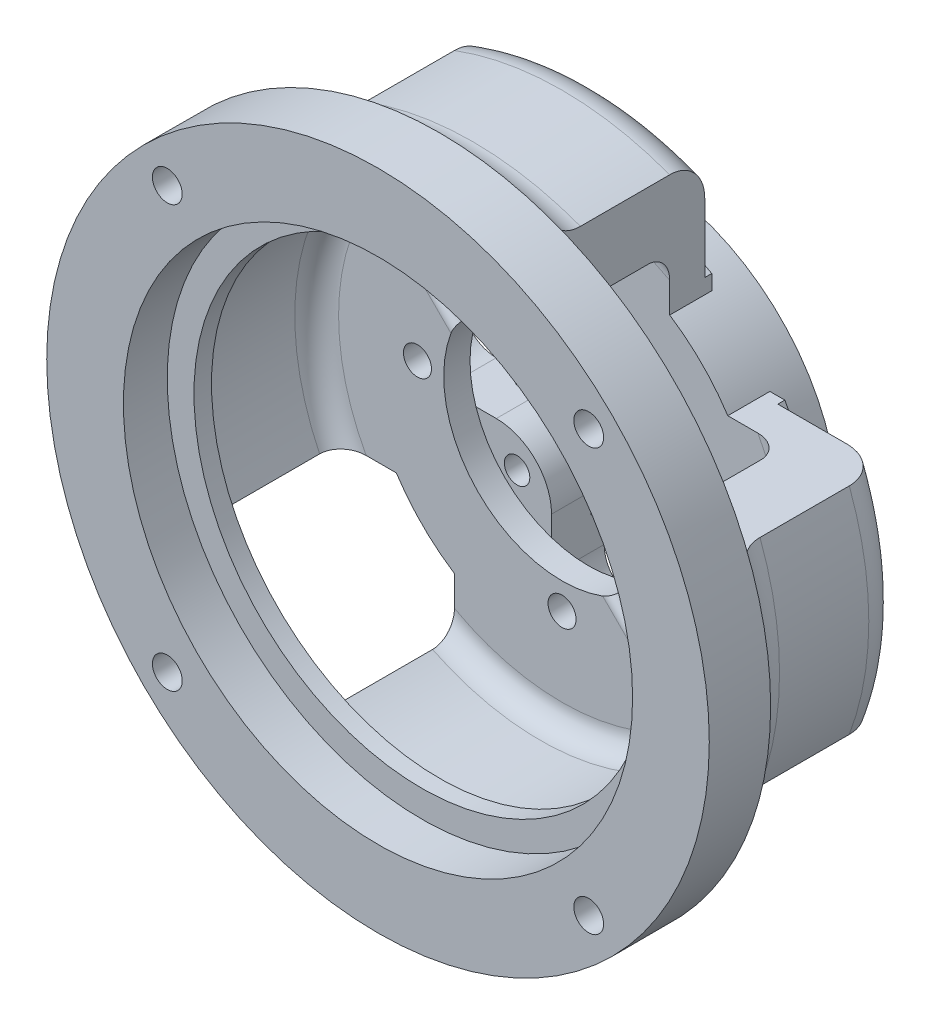
from build123d import *

# Parameters (mm, degrees)
SKETCH_1_W                    = 37.8
SKETCH_1_H                    = 6
CUT_EXTRUDE_1_DEPTH           = 2.5
HOLE_WIZARD_M48_1_D           = 52
HOLE_WIZARD_M48_1_CBORE_D     = 58.1
HOLE_WIZARD_M48_1_CBORE_DEPTH = 4
CUT_EXTRUDE_2_DEPTH           = 54.792936339
CUT_EXTRUDE_2_DEPTH_BACK      = 6
SKETCH_17_R                   = 1.7
SKETCH_18_R                   = 35
EXTRUDE_1_DEPTH               = 23
SKETCH_19_R                   = 28
CUT_EXTRUDE_3_DEPTH           = 14
CUT_EXTRUDE_START             = -23
SKETCH_20_R                   = 13.5
CUT_EXTRUDE_5_DEPTH           = 23
CUT_EXTRUDE_6_DEPTH           = 6
SKETCH_22_R                   = 1.6
CUT_EXTRUDE_7_DEPTH           = 3
SKETCH_24_R                   = 1.45
EXTRUDE_2_DEPTH               = 4.5
CUT_EXTRUDE_START_2           = -5
SKETCH_25_R                   = 35
SKETCH_25_R_2                 = 24
CUT_EXTRUDE_8_DEPTH           = 5
CUT_EXTRUDE_START_3           = -4.2
SKETCH_27_R                   = 24
SKETCH_27_R_2                 = 22.55
CUT_EXTRUDE_9_DEPTH           = 4.2
CUT_EXTRUDE_10_DEPTH          = 1.5
FILLET_1_R                    = 4
FILLET_2_R                    = 2.5
CUT_EXTRUDE_11_DEPTH          = 76.28451395
CUT_EXTRUDE_11_DEPTH_BACK     = 76.28451395
SKETCH_31_W                   = 9.376817256
SKETCH_31_H                   = 2.4
FILLET_3_R                    = 1
FILLET_4_R                    = 4
SKETCH_33_R                   = 37.8
SKETCH_33_R_2                 = 29.05
SKETCH_33_R_3                 = 1.7
EXTRUDE_3_DEPTH               = 1


with BuildPart() as part:
    # 草图1 → 旋转1 (revolve)
    with BuildSketch(Plane(origin=(0, 0, 0), x_dir=(1, 0, 0), z_dir=(0, 1, 0))):
        with Locations((18.9, 27.010169219)):
            Rectangle(SKETCH_1_W, SKETCH_1_H)
    revolve(axis=Axis((0, 0, -30.010169219), (0, 0, 1)))

    # 草图2 → 切除-拉伸1 (cut)
    with BuildSketch(Plane(origin=(0, 0, -30.010169219), x_dir=(-1, 0, 0), z_dir=(0, 0, -1))):
        Polygon((-22.439483563, -21.26663056), (-25.643777557, -21.26663056), (-27.245924554, -24.04163056), (-25.643777557, -26.81663056), (-22.439483563, -26.81663056), (-20.837336566, -24.04163056), align=None)
        Polygon((-24.04163056, 27.245924554), (-26.81663056, 25.643777557), (-26.81663056, 22.439483563), (-24.04163056, 20.837336566), (-21.26663056, 22.439483563), (-21.26663056, 25.643777557), align=None)
        Polygon((27.245924554, 24.04163056), (25.643777557, 26.81663056), (22.439483563, 26.81663056), (20.837336566, 24.04163056), (22.439483563, 21.26663056), (25.643777557, 21.26663056), align=None)
        Polygon((24.04163056, -27.245924554), (26.81663056, -25.643777557), (26.81663056, -22.439483563), (24.04163056, -20.837336566), (21.26663056, -22.439483563), (21.26663056, -25.643777557), align=None)
    extrude(amount=-CUT_EXTRUDE_1_DEPTH, mode=Mode.SUBTRACT)

    # M48 六角头螺栓的柱形沉头孔1 (through all)
    with Locations(Plane.XY.offset(-24.010169219)):
        with Locations((0, 0)):
            CounterBoreHole(HOLE_WIZARD_M48_1_D / 2, HOLE_WIZARD_M48_1_CBORE_D / 2, HOLE_WIZARD_M48_1_CBORE_DEPTH)

    # 草图17 → 切除-拉伸2 (cut, two sides: drawn at the far end of the back side and taken through both)
    with BuildSketch(Plane(origin=(0, 0, -30.010169219), x_dir=(-1, 0, 0), z_dir=(0, 0, -1)).offset(-CUT_EXTRUDE_2_DEPTH_BACK)):
        with Locations(Location((-24.04163056, -24.04163056, 0), (0, 0, 180))):
            Circle(SKETCH_17_R)
        with Locations(Location((-24.04163056, 24.04163056, 0), (0, 0, 180))):
            Circle(SKETCH_17_R)
        with Locations(Location((24.04163056, 24.04163056, 0), (0, 0, 180))):
            Circle(SKETCH_17_R)
        with Locations(Location((24.04163056, -24.04163056, 0), (0, 0, 180))):
            Circle(SKETCH_17_R)
    extrude(amount=CUT_EXTRUDE_2_DEPTH + CUT_EXTRUDE_2_DEPTH_BACK, mode=Mode.SUBTRACT)

    # 草图18 → 凸台-拉伸1 (add)
    with BuildSketch(Plane(origin=(0, 0, -30.010169219), x_dir=(-1, 0, 0), z_dir=(0, 0, -1))):
        with Locations(Location((0, 0, 0), (0, 0, 140.012926648))):
            Circle(SKETCH_18_R)
    extrude(amount=EXTRUDE_1_DEPTH)

    # 草图19 → 切除-拉伸3 (cut)
    with BuildSketch(Plane.XY.offset(-30.010169219)):
        Circle(SKETCH_19_R)
    extrude(amount=-CUT_EXTRUDE_3_DEPTH, mode=Mode.SUBTRACT)

    # 草图20 → 切除-拉伸5 (cut)
    with BuildSketch(Plane(origin=(0, 0, -53.010169219), x_dir=(-1, 0, 0), z_dir=(0, 0, -1)).offset(CUT_EXTRUDE_START)):
        with BuildLine():
            ThreePointArc((-12.28161024, -18.912021307), (-15.945257916, -15.945257916), (-18.912021307, -12.28161024))
            Line((-18.912021307, -12.28161024), (-32.774411511, -12.28161024))
            ThreePointArc((-32.774411511, -12.28161024), (-24.748737342, -24.748737342), (-12.28161024, -32.774411511))
            Line((-12.28161024, -32.774411511), (-12.28161024, -18.912021307))
        make_face()
        with BuildLine():
            ThreePointArc((-12.28161024, 32.774411511), (-24.748737342, 24.748737342), (-32.774411511, 12.28161024))
            Line((-32.774411511, 12.28161024), (-18.912021307, 12.28161024))
            ThreePointArc((-18.912021307, 12.28161024), (-15.945257916, 15.945257916), (-12.28161024, 18.912021307))
            Line((-12.28161024, 18.912021307), (-12.28161024, 32.774411511))
        make_face()
        with BuildLine():
            Line((12.28161024, -18.912021307), (12.28161024, -32.774411511))
            ThreePointArc((12.28161024, -32.774411511), (24.748737342, -24.748737342), (32.774411511, -12.28161024))
            Line((32.774411511, -12.28161024), (18.912021307, -12.28161024))
            ThreePointArc((18.912021307, -12.28161024), (15.945257916, -15.945257916), (12.28161024, -18.912021307))
        make_face()
        with BuildLine():
            ThreePointArc((32.774411511, 12.28161024), (24.748737342, 24.748737342), (12.28161024, 32.774411511))
            Line((12.28161024, 32.774411511), (12.28161024, 18.912021307))
            ThreePointArc((12.28161024, 18.912021307), (15.945257916, 15.945257916), (18.912021307, 12.28161024))
            Line((18.912021307, 12.28161024), (32.774411511, 12.28161024))
        make_face()
        Circle(SKETCH_20_R)
    extrude(amount=CUT_EXTRUDE_5_DEPTH, mode=Mode.SUBTRACT)

    # 草图21 → 切除-拉伸6 (cut)
    with BuildSketch(Plane(origin=(0, 0, -53.010169219), x_dir=(-1, 0, 0), z_dir=(0, 0, -1))):
        with BuildLine():
            Line((-4.2, 16.5), (-4.2, 10.5))
            ThreePointArc((-4.2, 10.5), (-6.045227279, 6.045227279), (-10.5, 4.2))
            Line((-10.5, 4.2), (-16.5, 4.2))
            ThreePointArc((-16.5, 4.2), (-19.328427125, 3.028427125), (-20.5, 0.2))
            Line((-20.5, 0.2), (-20.5, -0.2))
            ThreePointArc((-20.5, -0.2), (-19.328427125, -3.028427125), (-16.5, -4.2))
            Line((-16.5, -4.2), (-10.5, -4.2))
            ThreePointArc((-10.5, -4.2), (-6.045227279, -6.045227279), (-4.2, -10.5))
            Line((-4.2, -10.5), (-4.2, -16.5))
            ThreePointArc((-4.2, -16.5), (-3.028427125, -19.328427125), (-0.2, -20.5))
            Line((-0.2, -20.5), (0.2, -20.5))
            ThreePointArc((0.2, -20.5), (3.028427125, -19.328427125), (4.2, -16.5))
            Line((4.2, -16.5), (4.2, -10.5))
            ThreePointArc((4.2, -10.5), (6.045227279, -6.045227279), (10.5, -4.2))
            Line((10.5, -4.2), (16.5, -4.2))
            ThreePointArc((16.5, -4.2), (19.328427125, -3.028427125), (20.5, -0.2))
            Line((20.5, -0.2), (20.5, 0.2))
            ThreePointArc((20.5, 0.2), (19.328427125, 3.028427125), (16.5, 4.2))
            Line((16.5, 4.2), (10.5, 4.2))
            ThreePointArc((10.5, 4.2), (6.045227279, 6.045227279), (4.2, 10.5))
            Line((4.2, 10.5), (4.2, 16.5))
            ThreePointArc((4.2, 16.5), (3.028427125, 19.328427125), (0.2, 20.5))
            Line((0.2, 20.5), (-0.2, 20.5))
            ThreePointArc((-0.2, 20.5), (-3.028427125, 19.328427125), (-4.2, 16.5))
        make_face()
    extrude(amount=-CUT_EXTRUDE_6_DEPTH, mode=Mode.SUBTRACT)

    # 草图22 → 切除-拉伸7 (cut)
    with BuildSketch(Plane(origin=(0, 0, -47.010169219), x_dir=(-1, 0, 0), z_dir=(0, 0, -1))):
        with Locations((-16.5, 0)):
            Circle(SKETCH_22_R)
        with Locations((0, 16.5)):
            Circle(SKETCH_22_R)
        with Locations((16.5, 0)):
            Circle(SKETCH_22_R)
        with Locations((0, -16.5)):
            Circle(SKETCH_22_R)
    extrude(amount=-CUT_EXTRUDE_7_DEPTH, mode=Mode.SUBTRACT)

    # 草图24 → 凸台-拉伸2 (add)
    # profile 1 of 4: a face of its own
    with BuildSketch(Plane(origin=(0, 0, -47.010169219), x_dir=(-1, 0, 0), z_dir=(0, 0, -1))):
        with BuildLine():
            Line((-10.5, -4.2), (-12.830042868, -4.2))
            ThreePointArc((-12.830042868, -4.2), (-9.545941546, -9.545941546), (-4.2, -12.830042868))
            Line((-4.2, -12.830042868), (-4.2, -10.5))
            ThreePointArc((-4.2, -10.5), (-6.045227279, -6.045227279), (-10.5, -4.2))
        make_face()
        with Locations((-8.131727984, -8.131727984)):
            Circle(SKETCH_24_R, mode=Mode.SUBTRACT)
    # profile 2 of 4: a face of its own
    with BuildSketch(Plane(origin=(0, 0, -47.010169219), x_dir=(-1, 0, 0), z_dir=(0, 0, -1))):
        with BuildLine():
            ThreePointArc((-4.2, 12.830042868), (-9.545941546, 9.545941546), (-12.830042868, 4.2))
            Line((-12.830042868, 4.2), (-10.5, 4.2))
            ThreePointArc((-10.5, 4.2), (-6.045227279, 6.045227279), (-4.2, 10.5))
            Line((-4.2, 10.5), (-4.2, 12.830042868))
        make_face()
        with Locations((-8.131727984, 8.131727984)):
            Circle(SKETCH_24_R, mode=Mode.SUBTRACT)
    # profile 3 of 4: a face of its own
    with BuildSketch(Plane(origin=(0, 0, -47.010169219), x_dir=(-1, 0, 0), z_dir=(0, 0, -1))):
        with BuildLine():
            Line((4.2, -10.5), (4.2, -12.830042868))
            ThreePointArc((4.2, -12.830042868), (9.545941546, -9.545941546), (12.830042868, -4.2))
            Line((12.830042868, -4.2), (10.5, -4.2))
            ThreePointArc((10.5, -4.2), (6.045227279, -6.045227279), (4.2, -10.5))
        make_face()
        with Locations((8.131727984, -8.131727984)):
            Circle(SKETCH_24_R, mode=Mode.SUBTRACT)
    # profile 4 of 4: a face of its own
    with BuildSketch(Plane(origin=(0, 0, -47.010169219), x_dir=(-1, 0, 0), z_dir=(0, 0, -1))):
        with BuildLine():
            ThreePointArc((12.830042868, 4.2), (9.545941546, 9.545941546), (4.2, 12.830042868))
            Line((4.2, 12.830042868), (4.2, 10.5))
            ThreePointArc((4.2, 10.5), (6.045227279, 6.045227279), (10.5, 4.2))
            Line((10.5, 4.2), (12.830042868, 4.2))
        make_face()
        with Locations((8.131727984, 8.131727984)):
            Circle(SKETCH_24_R, mode=Mode.SUBTRACT)
    extrude(amount=EXTRUDE_2_DEPTH)

    # 草图25 → 切除-拉伸8 (cut)
    with BuildSketch(Plane(origin=(0, 0, -53.010169219), x_dir=(-1, 0, 0), z_dir=(0, 0, -1)).offset(CUT_EXTRUDE_START_2)):
        Circle(SKETCH_25_R)
        Circle(SKETCH_25_R_2, mode=Mode.SUBTRACT)
    extrude(amount=CUT_EXTRUDE_8_DEPTH, mode=Mode.SUBTRACT)

    # 草图27 → 切除-拉伸9 (cut)
    with BuildSketch(Plane(origin=(0, 0, -53.010169219), x_dir=(-1, 0, 0), z_dir=(0, 0, -1)).offset(CUT_EXTRUDE_START_3)):
        Circle(SKETCH_27_R)
        Circle(SKETCH_27_R_2, mode=Mode.SUBTRACT)
    extrude(amount=CUT_EXTRUDE_9_DEPTH, mode=Mode.SUBTRACT)

    # 草图29 → 切除-拉伸10 (cut)
    with BuildSketch(Plane(origin=(0, 0, -53.010169219), x_dir=(-1, 0, 0), z_dir=(0, 0, -1))):
        with BuildLine():
            Line((-9.5, 11.5), (9.5, 11.5))
            ThreePointArc((9.5, 11.5), (10.914213562, 10.914213562), (11.5, 9.5))
            Line((11.5, 9.5), (11.5, -9.5))
            ThreePointArc((11.5, -9.5), (10.914213562, -10.914213562), (9.5, -11.5))
            Line((9.5, -11.5), (-9.5, -11.5))
            ThreePointArc((-9.5, -11.5), (-10.914213562, -10.914213562), (-11.5, -9.5))
            Line((-11.5, -9.5), (-11.5, 9.5))
            ThreePointArc((-11.5, 9.5), (-10.914213562, 10.914213562), (-9.5, 11.5))
        make_face()
    extrude(amount=-CUT_EXTRUDE_10_DEPTH, mode=Mode.SUBTRACT)

    # 圆角1
    fillet_1_edges = [part.edges().sort_by_distance(p)[0] for p in [
        (35, 0, -48.010169219),
        (0, 35, -48.010169219),
        (-35, 0, -48.010169219),
        (0, -35, -48.010169219),
    ]]
    fillet(fillet_1_edges, radius=FILLET_1_R)

    # 圆角2
    fillet_2_edges = [part.edges().sort_by_distance(p)[0] for p in [
        (0, 28, -44.010169219),
        (-28, 0, -44.010169219),
        (0, -28, -44.010169219),
        (28, 0, -44.010169219),
    ]]
    fillet(fillet_2_edges, radius=FILLET_2_R)

    # 草图31 → 切除-拉伸11 (cut, two sides: drawn at the far end of the back side and taken through both)
    with BuildSketch(Plane(origin=(0, 0, 0), x_dir=(-0.7071067811865476, -0.7071067811865476, 0), z_dir=(0.7071067811865476, -0.7071067811865476, 0)).offset(-CUT_EXTRUDE_11_DEPTH_BACK)):
        with Locations((0, 45.210169219)):
            Rectangle(SKETCH_31_W, SKETCH_31_H)
    extrude(amount=CUT_EXTRUDE_11_DEPTH + CUT_EXTRUDE_11_DEPTH_BACK, mode=Mode.SUBTRACT)

    # 圆角3
    # the kernel refuses this fillet: 1 mm, written as the material it adds along each edge
    with BuildSketch(Plane(origin=(20.67978826, -14.049377193, -46.410169219), x_dir=(0, 0, 1), z_dir=(-0.7071067811865476, 0.7071067811865476, 0))) as fillet_3_piece_1_section:
        with BuildLine():
            CenterArc((FILLET_3_R, -FILLET_3_R), FILLET_3_R, 90, 90)
            Line((0, -FILLET_3_R), (0, 0))
            Line((0, 0), (FILLET_3_R, 0))
        make_face()
    fillet_3_piece_1 = extrude(amount=14.397495993, mode=Mode.PRIVATE)
    fillet_3_piece_1 = split(fillet_3_piece_1, bisect_by=Plane(origin=(18.487201152, -12.28161024, -46.303314163), z_dir=(0, -1, 0)), keep=Keep.TOP, mode=Mode.PRIVATE)
    fillet_3_piece_1 = fillet_3_piece_1 & Plane(origin=(0, 0, -46.303314163), x_dir=(0.5446390350150296, -0.8386705679454224, 0), z_dir=(0, 0, 1)) * Cylinder(22.55, 33, mode=Mode.PRIVATE)
    add(fillet_3_piece_1)
    with BuildSketch(Plane(origin=(20.67978826, -14.049377193, -46.410169219), x_dir=(0, 0, 1), z_dir=(-0.7071067811865476, 0.7071067811865476, 0))) as fillet_3_piece_2_section:
        with BuildLine():
            CenterArc((FILLET_3_R, -FILLET_3_R), FILLET_3_R, 90, 90)
            Line((0, -FILLET_3_R), (0, 0))
            Line((0, 0), (FILLET_3_R, 0))
        make_face()
    fillet_3_piece_2 = extrude(amount=14.397495993, mode=Mode.PRIVATE)
    fillet_3_piece_2 = split(fillet_3_piece_2, bisect_by=Plane(origin=(15.383550051, -12.28161024, -46.179741541), z_dir=(0, 1, 0)), keep=Keep.TOP, mode=Mode.PRIVATE)
    fillet_3_piece_2 = fillet_3_piece_2 - Plane(origin=(0, 0, -46.179741541), x_dir=(-1, 0, 0), z_dir=(0, 0, 1)) * Cylinder(13.5, 33, mode=Mode.PRIVATE)
    fillet_3_piece_2 = fillet_3_piece_2 & Plane(origin=(0, 0, -46.179741541), x_dir=(0.5446390350150296, -0.8386705679454224, 0), z_dir=(0, 0, 1)) * Cylinder(22.55, 33, mode=Mode.PRIVATE)
    add(fillet_3_piece_2)
    with BuildSketch(Plane(origin=(-3.868810144, 10.499221212, -46.410169219), x_dir=(0, 0, 1), z_dir=(-0.7071067811865476, 0.7071067811865476, 0))) as fillet_3_piece_3_section:
        with BuildLine():
            CenterArc((FILLET_3_R, -FILLET_3_R), FILLET_3_R, 90, 90)
            Line((0, -FILLET_3_R), (0, 0))
            Line((0, 0), (FILLET_3_R, 0))
        make_face()
    fillet_3_piece_3 = extrude(amount=14.397495993, mode=Mode.PRIVATE)
    fillet_3_piece_3 = split(fillet_3_piece_3, bisect_by=Plane(origin=(-12.28161024, 15.383571152, -46.179742656), z_dir=(1, 0, 0)), keep=Keep.TOP, mode=Mode.PRIVATE)
    fillet_3_piece_3 = fillet_3_piece_3 - Plane(origin=(0, 0, -46.179742656), x_dir=(-1, 0, 0), z_dir=(0, 0, 1)) * Cylinder(13.5, 33, mode=Mode.PRIVATE)
    fillet_3_piece_3 = fillet_3_piece_3 & Plane(origin=(0, 0, -46.179742656), x_dir=(-0.54463903501503, 0.8386705679454223, 0), z_dir=(0, 0, 1)) * Cylinder(22.55, 33, mode=Mode.PRIVATE)
    add(fillet_3_piece_3)
    with BuildSketch(Plane(origin=(-3.868810144, 10.499221212, -46.410169219), x_dir=(0, 0, 1), z_dir=(-0.7071067811865476, 0.7071067811865476, 0))) as fillet_3_piece_4_section:
        with BuildLine():
            CenterArc((FILLET_3_R, -FILLET_3_R), FILLET_3_R, 90, 90)
            Line((0, -FILLET_3_R), (0, 0))
            Line((0, 0), (FILLET_3_R, 0))
        make_face()
    fillet_3_piece_4 = extrude(amount=14.397495993, mode=Mode.PRIVATE)
    fillet_3_piece_4 = split(fillet_3_piece_4, bisect_by=Plane(origin=(-12.28161024, 18.487198774, -46.303316227), z_dir=(-1, 0, 0)), keep=Keep.TOP, mode=Mode.PRIVATE)
    fillet_3_piece_4 = fillet_3_piece_4 & Plane(origin=(0, 0, -46.303316227), x_dir=(-0.54463903501503, 0.8386705679454223, 0), z_dir=(0, 0, 1)) * Cylinder(22.55, 33, mode=Mode.PRIVATE)
    add(fillet_3_piece_4)
    with BuildSketch(Plane(origin=(-20.67978826, 14.049377193, -46.410169219), x_dir=(0, 0, 1), z_dir=(0.7071067811865476, -0.7071067811865476, 0))) as fillet_3_piece_5_section:
        with BuildLine():
            CenterArc((FILLET_3_R, -FILLET_3_R), FILLET_3_R, 90, 90)
            Line((0, -FILLET_3_R), (0, 0))
            Line((0, 0), (FILLET_3_R, 0))
        make_face()
    fillet_3_piece_5 = extrude(amount=14.397495993, mode=Mode.PRIVATE)
    fillet_3_piece_5 = split(fillet_3_piece_5, bisect_by=Plane(origin=(-18.487199589, 12.28161024, -46.30331484), z_dir=(0, 1, 0)), keep=Keep.TOP, mode=Mode.PRIVATE)
    fillet_3_piece_5 = fillet_3_piece_5 & Plane(origin=(0, 0, -46.30331484), x_dir=(-0.54463903501503, 0.8386705679454223, 0), z_dir=(0, 0, 1)) * Cylinder(22.55, 33, mode=Mode.PRIVATE)
    add(fillet_3_piece_5)
    with BuildSketch(Plane(origin=(-20.67978826, 14.049377193, -46.410169219), x_dir=(0, 0, 1), z_dir=(0.7071067811865476, -0.7071067811865476, 0))) as fillet_3_piece_6_section:
        with BuildLine():
            CenterArc((FILLET_3_R, -FILLET_3_R), FILLET_3_R, 90, 90)
            Line((0, -FILLET_3_R), (0, 0))
            Line((0, 0), (FILLET_3_R, 0))
        make_face()
    fillet_3_piece_6 = extrude(amount=14.397495993, mode=Mode.PRIVATE)
    fillet_3_piece_6 = split(fillet_3_piece_6, bisect_by=Plane(origin=(-15.383555682, 12.28161024, -46.179741819), z_dir=(0, -1, 0)), keep=Keep.TOP, mode=Mode.PRIVATE)
    fillet_3_piece_6 = fillet_3_piece_6 - Plane(origin=(0, 0, -46.179741819), x_dir=(-1, 0, 0), z_dir=(0, 0, 1)) * Cylinder(13.5, 33, mode=Mode.PRIVATE)
    fillet_3_piece_6 = fillet_3_piece_6 & Plane(origin=(0, 0, -46.179741819), x_dir=(-0.54463903501503, 0.8386705679454223, 0), z_dir=(0, 0, 1)) * Cylinder(22.55, 33, mode=Mode.PRIVATE)
    add(fillet_3_piece_6)
    with BuildSketch(Plane(origin=(3.868810144, -10.499221212, -46.410169219), x_dir=(0, 0, 1), z_dir=(0.7071067811865476, -0.7071067811865476, 0))) as fillet_3_piece_7_section:
        with BuildLine():
            CenterArc((FILLET_3_R, -FILLET_3_R), FILLET_3_R, 90, 90)
            Line((0, -FILLET_3_R), (0, 0))
            Line((0, 0), (FILLET_3_R, 0))
        make_face()
    fillet_3_piece_7 = extrude(amount=14.397495993, mode=Mode.PRIVATE)
    fillet_3_piece_7 = split(fillet_3_piece_7, bisect_by=Plane(origin=(12.28161024, -15.383573301, -46.179742782), z_dir=(-1, 0, 0)), keep=Keep.TOP, mode=Mode.PRIVATE)
    fillet_3_piece_7 = fillet_3_piece_7 - Plane(origin=(0, 0, -46.179742782), x_dir=(-1, 0, 0), z_dir=(0, 0, 1)) * Cylinder(13.5, 33, mode=Mode.PRIVATE)
    fillet_3_piece_7 = fillet_3_piece_7 & Plane(origin=(0, 0, -46.179742782), x_dir=(0.5446390350150296, -0.8386705679454224, 0), z_dir=(0, 0, 1)) * Cylinder(22.55, 33, mode=Mode.PRIVATE)
    add(fillet_3_piece_7)
    with BuildSketch(Plane(origin=(3.868810144, -10.499221212, -46.410169219), x_dir=(0, 0, 1), z_dir=(0.7071067811865476, -0.7071067811865476, 0))) as fillet_3_piece_8_section:
        with BuildLine():
            CenterArc((FILLET_3_R, -FILLET_3_R), FILLET_3_R, 90, 90)
            Line((0, -FILLET_3_R), (0, 0))
            Line((0, 0), (FILLET_3_R, 0))
        make_face()
    fillet_3_piece_8 = extrude(amount=14.397495993, mode=Mode.PRIVATE)
    fillet_3_piece_8 = split(fillet_3_piece_8, bisect_by=Plane(origin=(12.28161024, -18.487198774, -46.303316227), z_dir=(1, 0, 0)), keep=Keep.TOP, mode=Mode.PRIVATE)
    fillet_3_piece_8 = fillet_3_piece_8 & Plane(origin=(0, 0, -46.303316227), x_dir=(0.5446390350150296, -0.8386705679454224, 0), z_dir=(0, 0, 1)) * Cylinder(22.55, 33, mode=Mode.PRIVATE)
    add(fillet_3_piece_8)
    # the kernel refuses this fillet: 1 mm, written as the material it takes off along each edge
    with BuildSketch(Plane(origin=(20.67978826, -14.049377193, -44.010169219), x_dir=(0.7071067811865476, 0.7071067811865476, 0), z_dir=(-0.7071067811865476, 0.7071067811865476, 0)), Plane(origin=(-3.868810144, 10.499221212, -44.010169219), x_dir=(0.7071067811865476, 0.7071067811865476, 0), z_dir=(-0.7071067811865476, 0.7071067811865476, 0)), Plane(origin=(3.868810144, -10.499221212, -44.010169219), x_dir=(-0.7071067811865476, -0.7071067811865476, 0), z_dir=(0.7071067811865476, -0.7071067811865476, 0)), Plane(origin=(-20.67978826, 14.049377193, -44.010169219), x_dir=(-0.7071067811865476, -0.7071067811865476, 0), z_dir=(0.7071067811865476, -0.7071067811865476, 0))) as fillet_3_2_piece_1:
        with BuildLine():
            CenterArc((FILLET_3_R, FILLET_3_R), FILLET_3_R, 180, 90)
            Line((0, FILLET_3_R), (0, 0))
            Line((0, 0), (FILLET_3_R, 0))
        make_face()
    extrude(amount=14.397495993, mode=Mode.SUBTRACT)

    # 圆角4
    # the kernel refuses this fillet: 4 mm, written as the material it adds along each edge
    with BuildSketch(Plane(origin=(0, 0, -30.010169219), x_dir=(-0.5900431443070129, 0.8073717160368536, 0), z_dir=(-0.8073717160368536, -0.5900431443070129, 0))) as fillet_4_piece_1_section:
        with BuildLine():
            CenterArc((39, 3.815756806), FILLET_4_R, 180, 72.542396876)
            Line((35, 3.815756806), (34.92, 3.815756806))
            Line((34.92, 3.815756806), (34.92, 0))
            Line((34.92, 0), (35, -0.08))
            ThreePointArc((35, -0.08), (36.4, -0.08), (37.776, -0.076315136))
            Line((37.776, -0.076315136), (37.8, 0))
        make_face()
    fillet_4_piece_1 = revolve(axis=Axis((0, 0, -30.010169219), (0, 0, -1)), revolution_arc=72.320139823, mode=Mode.PRIVATE)
    fillet_4_piece_1 = split(fillet_4_piece_1, bisect_by=Plane(origin=(12.28161024, 34.985287555, -30.919045865), z_dir=(-1, 0, 0)), keep=Keep.TOP, mode=Mode.PRIVATE)
    fillet_4_piece_1 = split(fillet_4_piece_1, bisect_by=Plane(origin=(-12.28161024, 34.985287555, -30.919045865), z_dir=(1, 0, 0)), keep=Keep.TOP, mode=Mode.PRIVATE)
    add(fillet_4_piece_1)
    with BuildSketch(Plane(origin=(0, 0, -30.010169219), x_dir=(0.807371716036853, 0.5900431443070138, 0), z_dir=(-0.5900431443070138, 0.807371716036853, 0))) as fillet_4_piece_2_section:
        with BuildLine():
            CenterArc((39, 3.815756806), FILLET_4_R, 180, 72.542396876)
            Line((35, 3.815756806), (34.92, 3.815756806))
            Line((34.92, 3.815756806), (34.92, 0))
            Line((34.92, 0), (35, -0.08))
            ThreePointArc((35, -0.08), (36.4, -0.08), (37.776, -0.076315136))
            Line((37.776, -0.076315136), (37.8, 0))
        make_face()
    fillet_4_piece_2 = revolve(axis=Axis((0, 0, -30.010169219), (0, 0, -1)), revolution_arc=72.320139823, mode=Mode.PRIVATE)
    fillet_4_piece_2 = split(fillet_4_piece_2, bisect_by=Plane(origin=(34.985287572, -12.28161024, -30.919045831), z_dir=(0, 1, 0)), keep=Keep.TOP, mode=Mode.PRIVATE)
    fillet_4_piece_2 = split(fillet_4_piece_2, bisect_by=Plane(origin=(34.985287572, 12.28161024, -30.919045831), z_dir=(0, -1, 0)), keep=Keep.TOP, mode=Mode.PRIVATE)
    add(fillet_4_piece_2)
    with BuildSketch(Plane(origin=(0, 0, -30.010169219), x_dir=(0.5900431443070134, -0.8073717160368532, 0), z_dir=(0.8073717160368532, 0.5900431443070134, 0))) as fillet_4_piece_3_section:
        with BuildLine():
            CenterArc((39, 3.815756806), FILLET_4_R, 180, 72.542396876)
            Line((35, 3.815756806), (34.92, 3.815756806))
            Line((34.92, 3.815756806), (34.92, 0))
            Line((34.92, 0), (35, -0.08))
            ThreePointArc((35, -0.08), (36.4, -0.08), (37.776, -0.076315136))
            Line((37.776, -0.076315136), (37.8, 0))
        make_face()
    fillet_4_piece_3 = revolve(axis=Axis((0, 0, -30.010169219), (0, 0, -1)), revolution_arc=72.320139823, mode=Mode.PRIVATE)
    fillet_4_piece_3 = split(fillet_4_piece_3, bisect_by=Plane(origin=(12.28161024, -34.985287487, -30.919045898), z_dir=(-1, 0, 0)), keep=Keep.TOP, mode=Mode.PRIVATE)
    fillet_4_piece_3 = split(fillet_4_piece_3, bisect_by=Plane(origin=(-12.28161024, -34.985287487, -30.919045898), z_dir=(1, 0, 0)), keep=Keep.TOP, mode=Mode.PRIVATE)
    add(fillet_4_piece_3)
    with BuildSketch(Plane(origin=(0, 0, -30.010169219), x_dir=(-0.807371716036853, -0.5900431443070134, 0), z_dir=(0.5900431443070134, -0.807371716036853, 0))) as fillet_4_piece_4_section:
        with BuildLine():
            CenterArc((39, 3.815756806), FILLET_4_R, 180, 72.542396876)
            Line((35, 3.815756806), (34.92, 3.815756806))
            Line((34.92, 3.815756806), (34.92, 0))
            Line((34.92, 0), (35, -0.08))
            ThreePointArc((35, -0.08), (36.4, -0.08), (37.776, -0.076315136))
            Line((37.776, -0.076315136), (37.8, 0))
        make_face()
    fillet_4_piece_4 = revolve(axis=Axis((0, 0, -30.010169219), (0, 0, -1)), revolution_arc=72.320139823, mode=Mode.PRIVATE)
    fillet_4_piece_4 = split(fillet_4_piece_4, bisect_by=Plane(origin=(-34.985287564, -12.28161024, -30.919045839), z_dir=(0, 1, 0)), keep=Keep.TOP, mode=Mode.PRIVATE)
    fillet_4_piece_4 = split(fillet_4_piece_4, bisect_by=Plane(origin=(-34.985287564, 12.28161024, -30.919045839), z_dir=(0, -1, 0)), keep=Keep.TOP, mode=Mode.PRIVATE)
    add(fillet_4_piece_4)

    # 草图33 → 凸台-拉伸3 (add)
    with BuildSketch(Plane.XY.offset(-24.010169219)):
        Circle(SKETCH_33_R)
        Circle(SKETCH_33_R_2, mode=Mode.SUBTRACT)
        with Locations((-24.04163056, -24.04163056)):
            Circle(SKETCH_33_R_3, mode=Mode.SUBTRACT)
        with Locations((24.04163056, -24.04163056)):
            Circle(SKETCH_33_R_3, mode=Mode.SUBTRACT)
        with Locations((24.04163056, 24.04163056)):
            Circle(SKETCH_33_R_3, mode=Mode.SUBTRACT)
        with Locations((-24.04163056, 24.04163056)):
            Circle(SKETCH_33_R_3, mode=Mode.SUBTRACT)
    extrude(amount=EXTRUDE_3_DEPTH)


solid = part.part
